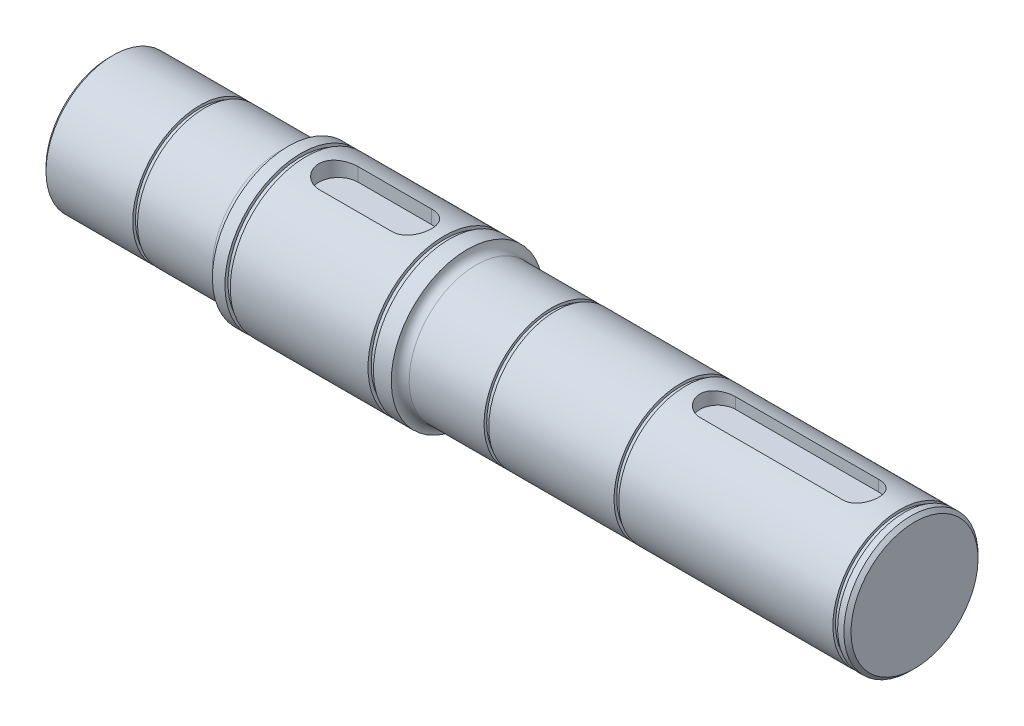
from build123d import *

# Parameters (mm, degrees)
ESQUISSE2_R              = 42.5
ESQUISSE2_R_2            = 40.75
ENL_V_MAT_EXTRU_1_DEPTH  = 3
ESQUISSE3_R              = 42.5
ESQUISSE3_R_2            = 40.75
ENL_V_MAT_EXTRU_2_DEPTH  = 3
ENL_V_MAT_EXTRU_3_DEPTH  = 9
ENL_V_MAT_EXTRU_4_DEPTH  = 7.5
CHANFREIN1_SIZE          = 2
ESQUISSE6_R              = 37.5
ESQUISSE6_R_2            = 36
ENL_V_MAT_EXTRU_5_DEPTH  = 2.65
ENL_V_START              = -2.65
ESQUISSE7_R              = 37.5
ESQUISSE7_R_2            = 36
ENL_V_MAT_EXTRU_6_DEPTH  = 2.65
ESQUISSE8_R              = 37.5
ESQUISSE8_R_2            = 36
ENL_V_MAT_EXTRU_7_DEPTH  = 2.65
ENL_V_START_2            = 2.65
ESQUISSE10_R             = 37.5
ESQUISSE10_R_2           = 36
ENL_V_MAT_EXTRU_11_DEPTH = 2.65


with BuildPart() as part:
    # Esquisse1 → Révolution1 (revolve)
    with BuildSketch(Plane.XY):
        with BuildLine():
            Line((0, 0), (0, 37.5))
            Line((0, 37.5), (95, 37.5))
            ThreePointArc((95, 37.5), (98.535533906, 38.964466094), (100, 42.5))
            Line((100, 42.5), (200, 42.5))
            ThreePointArc((200, 42.5), (201.464466094, 38.964466094), (205, 37.5))
            Line((205, 37.5), (450, 37.5))
            Line((450, 37.5), (450, 0))
            Line((450, 0), (0, 0))
        make_face()
    revolve(axis=Axis((450, 0, 0), (-1, 0, 0)))

    # Esquisse2 → Enlèv. mat.-Extru.1 (cut)
    with BuildSketch(Plane(origin=(110, 0, 0), x_dir=(0, 0, -1), z_dir=(1, 0, 0))):
        Circle(ESQUISSE2_R)
        Circle(ESQUISSE2_R_2, mode=Mode.SUBTRACT)
    extrude(amount=-ENL_V_MAT_EXTRU_1_DEPTH, mode=Mode.SUBTRACT)

    # Esquisse3 → Enlèv. mat.-Extru.2 (cut)
    with BuildSketch(Plane(origin=(190, 0, 0), x_dir=(0, 0, -1), z_dir=(1, 0, 0))):
        Circle(ESQUISSE3_R)
        Circle(ESQUISSE3_R_2, mode=Mode.SUBTRACT)
    extrude(amount=-ENL_V_MAT_EXTRU_2_DEPTH, mode=Mode.SUBTRACT)

    # Esquisse4 → Enlèv. mat.-Extru.3 (cut)
    with BuildSketch(Plane(origin=(0, 42.5, 0), x_dir=(1, 0, 0), z_dir=(0, 1, 0))):
        with BuildLine():
            Line((128, 11), (169, 11))
            ThreePointArc((169, 11), (180, 0), (169, -11))
            Line((169, -11), (128, -11))
            ThreePointArc((128, -11), (117, 0), (128, 11))
        make_face()
    extrude(amount=-ENL_V_MAT_EXTRU_3_DEPTH, mode=Mode.SUBTRACT)

    # Esquisse5 → Enlèv. mat.-Extru.4 (cut)
    with BuildSketch(Plane(origin=(0, 37.5, 0), x_dir=(1, 0, 0), z_dir=(0, 1, 0))):
        with BuildLine():
            Line((420, -10), (340, -10))
            ThreePointArc((340, -10), (330, 0), (340, 10))
            Line((340, 10), (420, 10))
            ThreePointArc((420, 10), (430, 0), (420, -10))
        make_face()
    extrude(amount=-ENL_V_MAT_EXTRU_4_DEPTH, mode=Mode.SUBTRACT)

    # Chanfrein1
    chanfrein1_edges = [part.edges().sort_by_distance(p)[0] for p in [
        (450, -37.5, 0),
        (0, -37.5, 0),
    ]]
    chamfer(chanfrein1_edges, length=CHANFREIN1_SIZE)

    # Esquisse6 → Enlèv. mat.-Extru.5 (cut)
    with BuildSketch(Plane(origin=(444.5, 0, 0), x_dir=(0, 0, -1), z_dir=(1, 0, 0))):
        Circle(ESQUISSE6_R)
        Circle(ESQUISSE6_R_2, mode=Mode.SUBTRACT)
    extrude(amount=-ENL_V_MAT_EXTRU_5_DEPTH, mode=Mode.SUBTRACT)

    # Esquisse7 → Enlèv. mat.-Extru.6 (cut)
    with BuildSketch(Plane.ZY.offset(-50.5).offset(ENL_V_START)):
        Circle(ESQUISSE7_R)
        Circle(ESQUISSE7_R_2, mode=Mode.SUBTRACT)
    extrude(amount=ENL_V_MAT_EXTRU_6_DEPTH, mode=Mode.SUBTRACT)

    # Esquisse8 → Enlèv. mat.-Extru.7 (cut)
    with BuildSketch(Plane.ZY.offset(-249.5)):
        Circle(ESQUISSE8_R)
        Circle(ESQUISSE8_R_2, mode=Mode.SUBTRACT)
    extrude(amount=ENL_V_MAT_EXTRU_7_DEPTH, mode=Mode.SUBTRACT)

    # Esquisse10 → Enlèv. mat.-Extru.11 (cut)
    with BuildSketch(Plane(origin=(319.5, 0, 0), x_dir=(0, 0, -1), z_dir=(1, 0, 0)).offset(ENL_V_START_2)):
        Circle(ESQUISSE10_R)
        Circle(ESQUISSE10_R_2, mode=Mode.SUBTRACT)
    extrude(amount=-ENL_V_MAT_EXTRU_11_DEPTH, mode=Mode.SUBTRACT)


solid = part.part
